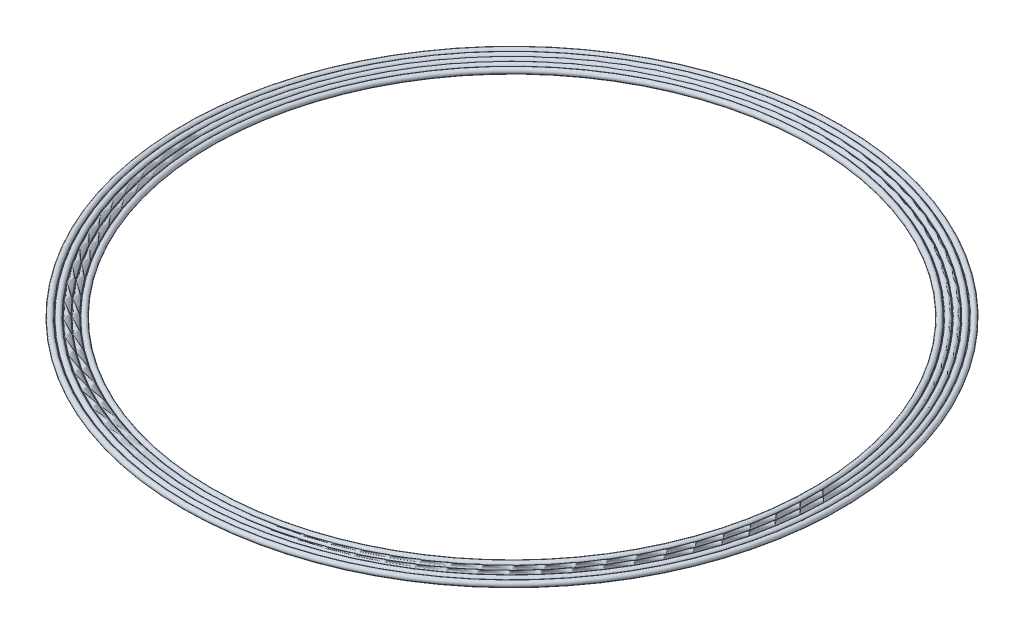
from build123d import *


with BuildPart() as part:
    # Sketch2 → Revolve1 (revolve)
    with BuildSketch(Plane.XY):
        with BuildLine():
            Line((92.576135582, 0.2), (92.773864418, 0.2))
            ThreePointArc((92.773864418, 0.2), (93.6, 0.85), (94.426135582, 0.2))
            Line((94.426135582, 0.2), (94.623864418, 0.2))
            ThreePointArc((94.623864418, 0.2), (95.45, 0.85), (96.276135582, 0.2))
            Line((96.276135582, 0.2), (96.473864418, 0.2))
            ThreePointArc((96.473864418, 0.2), (97.3, 0.85), (98.126135582, 0.2))
            Line((98.126135582, 0.2), (98.323864418, 0.2))
            ThreePointArc((98.323864418, 0.2), (100, 0), (98.323864418, -0.2))
            Line((98.323864418, -0.2), (98.126135582, -0.2))
            ThreePointArc((98.126135582, -0.2), (97.3, -0.85), (96.473864418, -0.2))
            Line((96.473864418, -0.2), (96.276135582, -0.2))
            ThreePointArc((96.276135582, -0.2), (95.45, -0.85), (94.623864418, -0.2))
            Line((94.623864418, -0.2), (94.426135582, -0.2))
            ThreePointArc((94.426135582, -0.2), (93.6, -0.85), (92.773864418, -0.2))
            Line((92.773864418, -0.2), (92.576135582, -0.2))
            ThreePointArc((92.576135582, -0.2), (90.9, 0), (92.576135582, 0.2))
        make_face()
    revolve(axis=Axis((0, 6.450627053, 0), (0, -1, 0)))


solid = part.part
